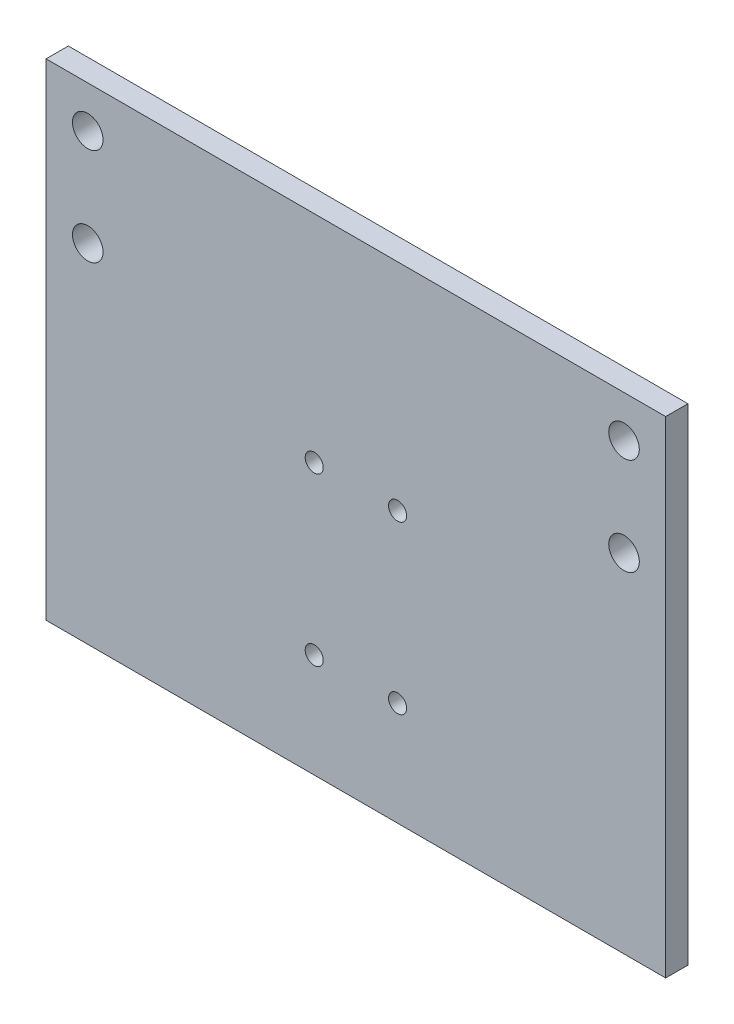
from build123d import *

# Parameters (mm, degrees)
SKETCH1_W          = 223
SKETCH1_H          = 175
SKETCH1_R          = 3.25
BASE_FLANGE1_DEPTH = 8
SKETCH2_R          = 5.5
CUT_EXTRUDE1_DEPTH = 142.959501267


# Sheet-metal steps are written as plain solids
with BuildPart() as part:
    # Sketch1 → Base-Flange1 (new body)
    with BuildSketch(Plane.XY):
        Rectangle(SKETCH1_W, SKETCH1_H)
        with Locations((15, 9.9)):
            Circle(SKETCH1_R, mode=Mode.SUBTRACT)
        with Locations((-15, 9.9)):
            Circle(SKETCH1_R, mode=Mode.SUBTRACT)
        with Locations((-15, -50.1)):
            Circle(SKETCH1_R, mode=Mode.SUBTRACT)
        with Locations((15, -50.1)):
            Circle(SKETCH1_R, mode=Mode.SUBTRACT)
    extrude(amount=-BASE_FLANGE1_DEPTH)

    # Sketch2 → Cut-Extrude1 (cut, through all)
    with BuildSketch(Plane.XY):
        with Locations((-96.5, 72.5)):
            Circle(SKETCH2_R)
        with Locations((-96.5, 37.5)):
            Circle(SKETCH2_R)
        with Locations(Location((96.5, 37.5, 0), (0, 0, 180))):
            Circle(SKETCH2_R)
        with Locations(Location((96.5, 72.5, 0), (0, 0, 180))):
            Circle(SKETCH2_R)
    extrude(amount=-CUT_EXTRUDE1_DEPTH, mode=Mode.SUBTRACT)


solid = part.part
